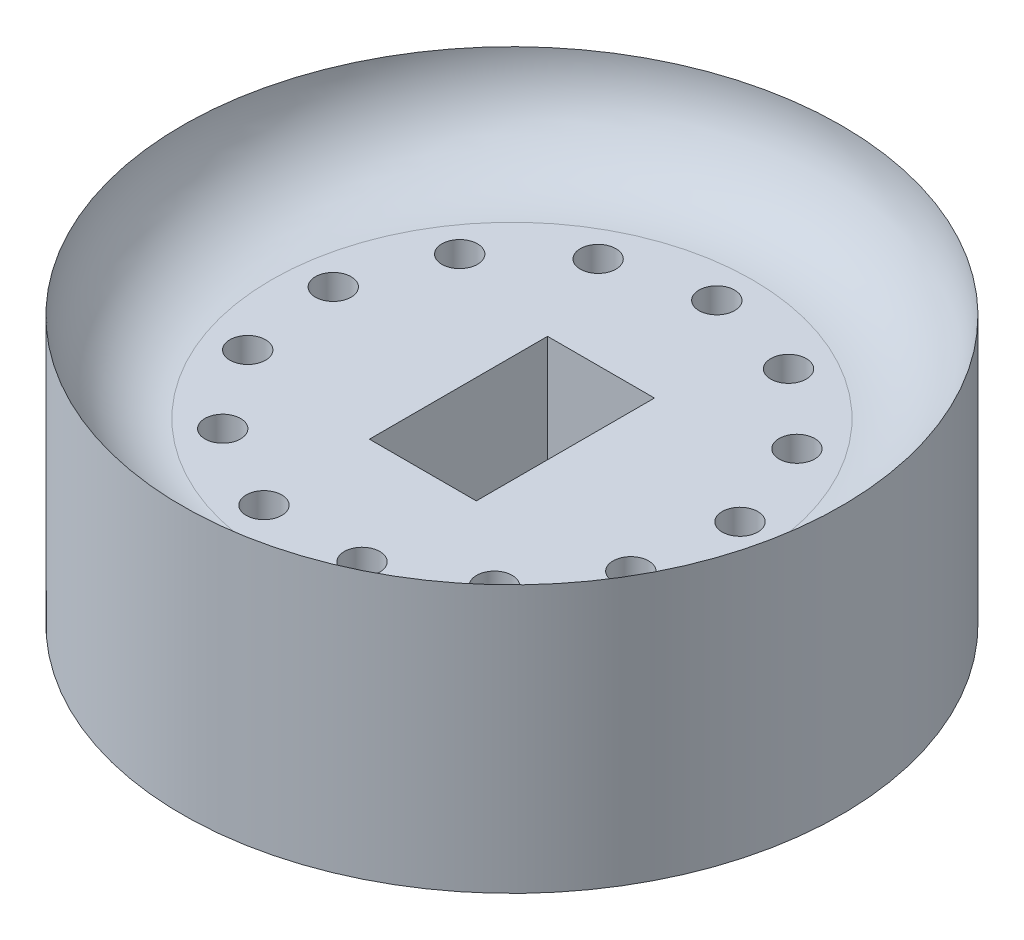
from build123d import *

# Parameters (mm, degrees)
CROQUIS2_R            = 0.5
CROQUIS2_W            = 3
CROQUIS2_H            = 5
CORTAR_EXTRUIR1_DEPTH = 15.004463574


with BuildPart() as part:
    # Croquis1 → Revolución1 (revolve)
    with BuildSketch(Plane.XY):
        with BuildLine():
            ThreePointArc((9.25, 7.5), (8.517766953, 5.732233047), (6.75, 5))
            Line((6.75, 5), (0, 5))
            Line((0, 5), (0, 0))
            Line((0, 0), (9.25, 0))
            Line((9.25, 0), (9.25, 7.5))
        make_face()
    revolve(axis=Axis((0, 0, 0), (0, 1, 0)))

    # Croquis2 → Cortar-Extruir1 (cut, through all)
    with BuildSketch(Plane(origin=(0, 5, 0), x_dir=(1, 0, 0), z_dir=(0, 1, 0))):
        with Locations((0, 5.75)):
            Circle(CROQUIS2_R)
        with Locations((2.672158239, 5.091372148)):
            Circle(CROQUIS2_R)
        with Locations((4.732157229, 3.266372294)):
            Circle(CROQUIS2_R)
        with Locations((5.708076026, 0.693085911)):
            Circle(CROQUIS2_R)
        with Locations((5.376343395, -2.0389781)):
            Circle(CROQUIS2_R)
        with Locations((3.812955285, -4.303936802)):
            Circle(CROQUIS2_R)
        with Locations((1.37606507, -5.58291545)):
            Circle(CROQUIS2_R)
        with Locations((-1.37606507, -5.58291545)):
            Circle(CROQUIS2_R)
        with Locations((-3.812955285, -4.303936802)):
            Circle(CROQUIS2_R)
        with Locations((-5.376343395, -2.0389781)):
            Circle(CROQUIS2_R)
        with Locations((-5.708076026, 0.693085911)):
            Circle(CROQUIS2_R)
        with Locations((-4.732157229, 3.266372294)):
            Circle(CROQUIS2_R)
        with Locations((-2.672158239, 5.091372148)):
            Circle(CROQUIS2_R)
        Rectangle(CROQUIS2_W, CROQUIS2_H)
    extrude(amount=-CORTAR_EXTRUIR1_DEPTH, mode=Mode.SUBTRACT)


solid = part.part
